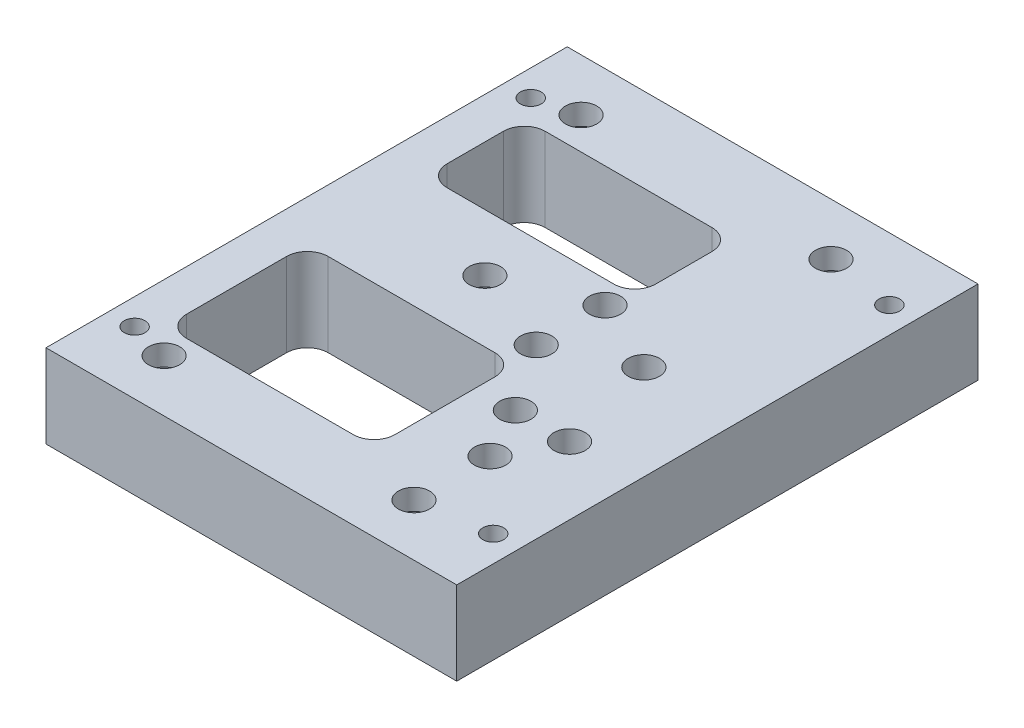
from build123d import *

# Parameters (mm, degrees)
SKETCH1_W                    = 197
SKETCH1_H                    = 250
BOSS_EXTRUDE1_DEPTH          = 40
CUT_EXTRUDE2_REACH           = 166.095
SKETCH3_R                    = 7.5
SKETCH4_R                    = 9
CUT_EXTRUDE3_DEPTH           = 5
SKETCH11_R                   = 7.5
CUT_EXTRUDE9_DEPTH           = 229.157307356
SKETCH12_R                   = 10
CUT_EXTRUDE10_DEPTH          = 5
SKETCH13_R                   = 10
CUT_EXTRUDE11_DEPTH          = 30
M10_TAPPED_HOLE1_D           = 8.5
M10_TAPPED_HOLE1_DEPTH       = 27.5
M10_TAPPED_HOLE1_CSINK_D     = 10.05
M10_TAPPED_HOLE1_CSINK_ANGLE = 90
M10_TAPPED_HOLE1_TIP         = 2.553657631
F_10_0MM_DOWEL_HOLE2_D       = 10
CUT_EXTRUDE12_REACH          = 166.095
SKETCH28_R                   = 7.5
SKETCH29_R                   = 9
CUT_EXTRUDE13_DEPTH          = 30


with BuildPart() as part:
    # Sketch1 → Boss-Extrude1 (new body)
    with BuildSketch(Plane(origin=(0, 0, 0), x_dir=(1, 0, 0), z_dir=(0, 1, 0))):
        Rectangle(SKETCH1_W, SKETCH1_H)
    extrude(amount=-BOSS_EXTRUDE1_DEPTH)

    # Sketch3 → Cut-Extrude2 (cut, up to next)
    with BuildSketch(Plane(origin=(0, 0, 0), x_dir=(1, 0, 0), z_dir=(0, 1, 0)), mode=Mode.PRIVATE) as cut_extrude2_sk1:
        with Locations((17.88, 26.73)):
            Circle(SKETCH3_R)
    cut_extrude2_tool1 = extrude(cut_extrude2_sk1.sketch, amount=-CUT_EXTRUDE2_REACH, mode=Mode.PRIVATE) & part.part
    # Sketch3 → Cut-Extrude2 (cut, up to next)
    with BuildSketch(Plane(origin=(0, 0, 0), x_dir=(1, 0, 0), z_dir=(0, 1, 0)), mode=Mode.PRIVATE) as cut_extrude2_sk2:
        with Locations((17.88, -6.27)):
            Circle(SKETCH3_R)
    cut_extrude2_tool2 = extrude(cut_extrude2_sk2.sketch, amount=-CUT_EXTRUDE2_REACH, mode=Mode.PRIVATE) & part.part
    # Sketch3 → Cut-Extrude2 (cut, up to next)
    with BuildSketch(Plane(origin=(0, 0, 0), x_dir=(1, 0, 0), z_dir=(0, 1, 0)), mode=Mode.PRIVATE) as cut_extrude2_sk3:
        with Locations((53, -63.53)):
            Circle(SKETCH3_R)
    cut_extrude2_tool3 = extrude(cut_extrude2_sk3.sketch, amount=-CUT_EXTRUDE2_REACH, mode=Mode.PRIVATE) & part.part
    # Sketch3 → Cut-Extrude2 (cut, up to next)
    with BuildSketch(Plane(origin=(0, 0, 0), x_dir=(1, 0, 0), z_dir=(0, 1, 0)), mode=Mode.PRIVATE) as cut_extrude2_sk4:
        with Locations((66, -38.4)):
            Circle(SKETCH3_R)
    cut_extrude2_tool4 = extrude(cut_extrude2_sk4.sketch, amount=-CUT_EXTRUDE2_REACH, mode=Mode.PRIVATE) & part.part
    # Sketch3 → Cut-Extrude2 (cut, up to next)
    with BuildSketch(Plane(origin=(0, 0, 0), x_dir=(1, 0, 0), z_dir=(0, 1, 0)), mode=Mode.PRIVATE) as cut_extrude2_sk5:
        with Locations((40, -38.4)):
            Circle(SKETCH3_R)
    cut_extrude2_tool5 = extrude(cut_extrude2_sk5.sketch, amount=-CUT_EXTRUDE2_REACH, mode=Mode.PRIVATE) & part.part
    # Sketch3 → Cut-Extrude2 (cut, up to next)
    with BuildSketch(Plane(origin=(0, 0, 0), x_dir=(1, 0, 0), z_dir=(0, 1, 0)), mode=Mode.PRIVATE) as cut_extrude2_sk6:
        with BuildLine():
            Line((-68.745, 84.63), (11.255, 84.63))
            ThreePointArc((11.255, 84.63), (18.326067812, 81.701067812), (21.255, 74.63))
            Line((21.255, 74.63), (21.255, 47.63))
            ThreePointArc((21.255, 47.63), (18.326067812, 40.558932188), (11.255, 37.63))
            Line((11.255, 37.63), (-68.745, 37.63))
            ThreePointArc((-68.745, 37.63), (-75.816067812, 40.558932188), (-78.745, 47.63))
            Line((-78.745, 47.63), (-78.745, 74.63))
            ThreePointArc((-78.745, 74.63), (-75.816067812, 81.701067812), (-68.745, 84.63))
        make_face()
    cut_extrude2_tool6 = extrude(cut_extrude2_sk6.sketch, amount=-CUT_EXTRUDE2_REACH, mode=Mode.PRIVATE) & part.part
    # Sketch3 → Cut-Extrude2 (cut, up to next)
    with BuildSketch(Plane(origin=(0, 0, 0), x_dir=(1, 0, 0), z_dir=(0, 1, 0)), mode=Mode.PRIVATE) as cut_extrude2_sk7:
        with BuildLine():
            Line((-68.745, -19.4), (11.255, -19.4))
            ThreePointArc((11.255, -19.4), (18.326067812, -22.328932188), (21.255, -29.4))
            Line((21.255, -29.4), (21.255, -77.4))
            ThreePointArc((21.255, -77.4), (18.326067812, -84.471067812), (11.255, -87.4))
            Line((11.255, -87.4), (-68.745, -87.4))
            ThreePointArc((-68.745, -87.4), (-75.816067812, -84.471067812), (-78.745, -77.4))
            Line((-78.745, -77.4), (-78.745, -29.4))
            ThreePointArc((-78.745, -29.4), (-75.816067812, -22.328932188), (-68.745, -19.4))
        make_face()
    cut_extrude2_tool7 = extrude(cut_extrude2_sk7.sketch, amount=-CUT_EXTRUDE2_REACH, mode=Mode.PRIVATE) & part.part
    add(cut_extrude2_tool1.solids().sort_by_distance((17.88, 0, -26.73))[0], mode=Mode.SUBTRACT)
    add(cut_extrude2_tool2.solids().sort_by_distance((17.88, 0, 6.27))[0], mode=Mode.SUBTRACT)
    add(cut_extrude2_tool3.solids().sort_by_distance((53, 0, 63.53))[0], mode=Mode.SUBTRACT)
    add(cut_extrude2_tool4.solids().sort_by_distance((66, 0, 38.4))[0], mode=Mode.SUBTRACT)
    add(cut_extrude2_tool5.solids().sort_by_distance((40, 0, 38.4))[0], mode=Mode.SUBTRACT)
    add(cut_extrude2_tool6.solids().sort_by_distance((-28.745, 0, -61.13))[0], mode=Mode.SUBTRACT)
    add(cut_extrude2_tool7.solids().sort_by_distance((-28.745, 0, 53.4))[0], mode=Mode.SUBTRACT)

    # Sketch4 → Cut-Extrude3 (cut)
    with BuildSketch(Plane.XZ.offset(40)):
        with Locations((17.88, -26.73)):
            Circle(SKETCH4_R)
        with Locations((17.88, 6.27)):
            Circle(SKETCH4_R)
        with Locations((40, 38.4)):
            Circle(SKETCH4_R)
        with Locations((66, 38.4)):
            Circle(SKETCH4_R)
        with Locations((53, 63.53)):
            Circle(SKETCH4_R)
    extrude(amount=-CUT_EXTRUDE3_DEPTH, mode=Mode.SUBTRACT)

    # Sketch11 → Cut-Extrude9 (cut, through all)
    with BuildSketch(Plane(origin=(88.13, 0, 0), x_dir=(1, 0, 0), z_dir=(0, 1, 0))):
        with Locations((-35.13, 10.23)):
            Circle(SKETCH11_R)
        with Locations((-111.38, 10.23)):
            Circle(SKETCH11_R)
    extrude(amount=-CUT_EXTRUDE9_DEPTH, mode=Mode.SUBTRACT)

    # Sketch12 → Cut-Extrude10 (cut)
    with BuildSketch(Plane(origin=(88.13, -40, 0), x_dir=(1, 0, 0), z_dir=(0, -1, 0))):
        with Locations((-35.13, -10.23)):
            Circle(SKETCH12_R)
    extrude(amount=-CUT_EXTRUDE10_DEPTH, mode=Mode.SUBTRACT)

    # Sketch13 → Cut-Extrude11 (cut)
    with BuildSketch(Plane(origin=(88.13, -40, 0), x_dir=(1, 0, 0), z_dir=(0, -1, 0))):
        with Locations((-111.38, -10.23)):
            Circle(SKETCH13_R)
    extrude(amount=-CUT_EXTRUDE11_DEPTH, mode=Mode.SUBTRACT)

    # M10 Tapped Hole1
    with Locations(Plane(origin=(0, -40, 0), x_dir=(-1, 0, 0), z_dir=(0, -1, 0))):
        with Locations((-86, 112.5), (86, 112.5), (86, -112.5), (-86, -112.5)):
            CounterSinkHole(M10_TAPPED_HOLE1_D / 2, M10_TAPPED_HOLE1_CSINK_D / 2, depth=M10_TAPPED_HOLE1_DEPTH, counter_sink_angle=M10_TAPPED_HOLE1_CSINK_ANGLE)
            with Locations((0, 0, -(M10_TAPPED_HOLE1_DEPTH + M10_TAPPED_HOLE1_TIP / 2))):  # 118° drill point
                Cone(0, M10_TAPPED_HOLE1_D / 2, M10_TAPPED_HOLE1_TIP, mode=Mode.SUBTRACT)

    # Ø10.0mm Dowel Hole2 (through all)
    with Locations(Plane(origin=(0, -40, 0), x_dir=(-1, 0, 0), z_dir=(0, -1, 0))):
        with Locations((-86, 95), (86, 95), (86, -95), (-86, -95)):
            Hole(F_10_0MM_DOWEL_HOLE2_D / 2)

    # Sketch28 → Cut-Extrude12 (cut, up to next)
    with BuildSketch(Plane(origin=(0, 0, 0), x_dir=(1, 0, 0), z_dir=(0, 1, 0)), mode=Mode.PRIVATE) as cut_extrude12_sk1:
        with Locations((53, -100)):
            Circle(SKETCH28_R)
    cut_extrude12_tool1 = extrude(cut_extrude12_sk1.sketch, amount=-CUT_EXTRUDE12_REACH, mode=Mode.PRIVATE) & part.part
    # Sketch28 → Cut-Extrude12 (cut, up to next)
    with BuildSketch(Plane(origin=(0, 0, 0), x_dir=(1, 0, 0), z_dir=(0, 1, 0)), mode=Mode.PRIVATE) as cut_extrude12_sk2:
        with Locations((-66.87, -100)):
            Circle(SKETCH28_R)
    cut_extrude12_tool2 = extrude(cut_extrude12_sk2.sketch, amount=-CUT_EXTRUDE12_REACH, mode=Mode.PRIVATE) & part.part
    cut_extrude12_1 = cut_extrude12_tool1.solids().sort_by_distance((53, 0, 100))[0]
    add(cut_extrude12_1, mode=Mode.SUBTRACT)
    cut_extrude12_2 = cut_extrude12_tool2.solids().sort_by_distance((-66.87, 0, 100))[0]
    add(cut_extrude12_2, mode=Mode.SUBTRACT)
    cut_extrude12 = cut_extrude12_1 + cut_extrude12_2  # Cut-Extrude12 as one shape, for the pattern or mirror that repeats it

    # Mirror1: Cut-Extrude12 across plane
    add(cut_extrude12.mirror(Plane.XY), mode=Mode.SUBTRACT)

    # Sketch29 → Cut-Extrude13 (cut)
    with BuildSketch(Plane.XZ.offset(40)):
        with Locations((-66.87, 100)):
            Circle(SKETCH29_R)
        with Locations((53, 100)):
            Circle(SKETCH29_R)
        with Locations((53, -100)):
            Circle(SKETCH29_R)
        with Locations((-66.87, -100)):
            Circle(SKETCH29_R)
    extrude(amount=-CUT_EXTRUDE13_DEPTH, mode=Mode.SUBTRACT)


solid = part.part
